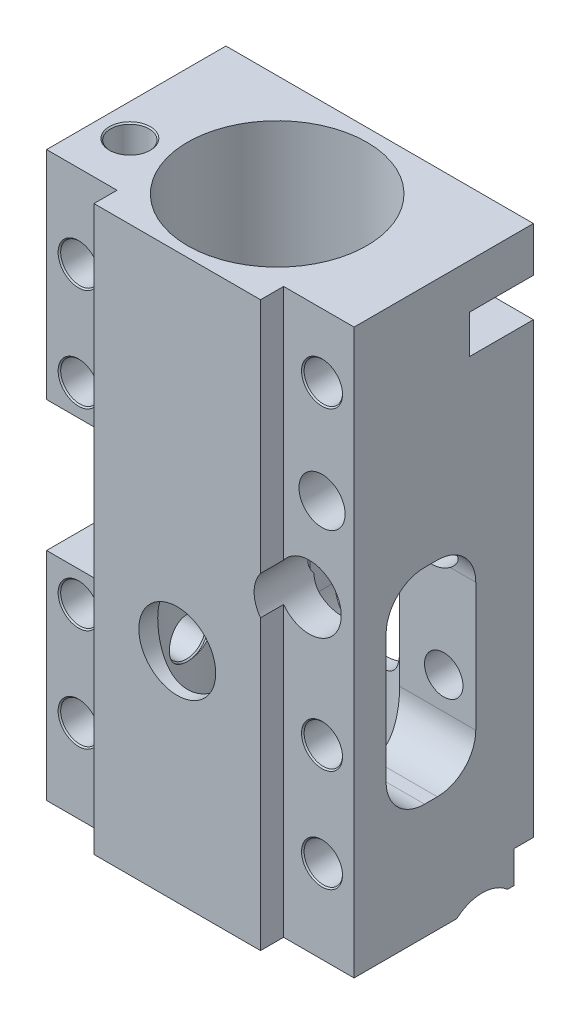
from build123d import *

# Parameters (mm, degrees)
SKETCH_2_R                 = 2.5
EXTRUDE_1_DEPTH            = 44
SKETCH_3_R                 = 7
CUT_EXTRUDE_1_DEPTH        = 42
CHAMFER_1_SIZE             = 2
CUT_EXTRUDE_START          = -37.5
CUT_EXTRUDE_10_DEPTH       = 3
CUT_EXTRUDE_2_REACH        = 50.266
CUT_EXTRUDE_2_END_RADIUS   = 7
CUT_EXTRUDE_3_REACH        = 52.754
CUT_EXTRUDE_3_END_RADIUS   = 7
HOLE_WIZARD_M3_D           = 3
HOLE_WIZARD_M3_CSINK_D     = 3.2
HOLE_WIZARD_M3_CSINK_ANGLE = 90
CUT_EXTRUDE_5_DEPTH        = 48.707441914
CUT_EXTRUDE_5_DEPTH_BACK   = 11
SKETCH_9_R                 = 2.5
CUT_EXTRUDE_6_DEPTH        = 48.369188443
CUT_EXTRUDE_6_DEPTH_BACK   = 48.369188443
SKETCH_10_R                = 1.5
SKETCH_10_R_2              = 1.8
CUT_EXTRUDE_11_REACH       = 50.266
CUT_EXTRUDE_11_END_RADIUS  = 7
SKETCH_14_R                = 3
SKETCH_15_W                = 14
SKETCH_15_H                = 10.2
CUT_EXTRUDE_13_DEPTH       = 4
SKETCH_16_W                = 1.5
SKETCH_16_H                = 2.5
CUT_EXTRUDE_14_DEPTH       = 51.754310312


# Read off the part's stored shape, not the designer's step: Отверстие M3_1, Отверстие обработанное метчиком M31
with BuildPart() as part:
    # Эскиз2 → Бобышка-Вытянуть1 (new body)
    with BuildSketch(Plane(origin=(0, 0, 0), x_dir=(1, 0, 0), z_dir=(0, 1, 0))):
        Polygon((-6.5, -7.8), (6.5, -7.8), (6.5, -6), (12, -6), (12, 8), (-12, 8), (-12, -6), (-6.5, -6), align=None)
        with Locations(Location((0, 0, 0), (0, 0, 270))):
            Circle(SKETCH_2_R, mode=Mode.SUBTRACT)
    extrude(amount=EXTRUDE_1_DEPTH)

    # Эскиз3 → Вырез-Вытянуть1 (cut)
    with BuildSketch(Plane(origin=(0, 44, 0), x_dir=(1, 0, 0), z_dir=(0, 1, 0))):
        with Locations(Location((0, 0, 0), (0, 0, 270))):
            Circle(SKETCH_3_R)
    extrude(amount=-CUT_EXTRUDE_1_DEPTH, mode=Mode.SUBTRACT)

    # Фаска1
    chamfer_1_edges = [part.edges().sort_by_distance(p)[0] for p in [
        (0, 2, -7),
    ]]
    chamfer(chamfer_1_edges, length=CHAMFER_1_SIZE)

    # Эскиз11 → Вырез-Вытянуть10 (cut)
    with BuildSketch(Plane.XZ.offset(CUT_EXTRUDE_START)):
        Polygon((12, -3), (7, -8), (12, -8), align=None)
    extrude(amount=-CUT_EXTRUDE_10_DEPTH, mode=Mode.SUBTRACT)

    # Вырез-Вытянуть2: up to this cylinder (the profile starts outside it)
    cut_extrude_2_end = Plane(origin=(0, 17, 0), z_dir=(0, 1, 0)) * Cylinder(CUT_EXTRUDE_2_END_RADIUS, 115.532, mode=Mode.PRIVATE)
    # Эскиз6 → Вырез-Вытянуть2 (cut, up to the surface)
    with BuildSketch(Plane(origin=(0, 0, -8), x_dir=(-1, 0, 0), z_dir=(0, 0, -1)), mode=Mode.PRIVATE) as cut_extrude_2_sk1:
        with BuildLine():
            Line((-0.5, 25), (0.5, 25))
            ThreePointArc((0.5, 25), (2.621320344, 24.121320344), (3.5, 22))
            Line((3.5, 22), (3.5, 12))
            ThreePointArc((3.5, 12), (2.621320344, 9.878679656), (0.5, 9))
            Line((0.5, 9), (-0.5, 9))
            ThreePointArc((-0.5, 9), (-2.621320344, 9.878679656), (-3.5, 12))
            Line((-3.5, 12), (-3.5, 22))
            ThreePointArc((-3.5, 22), (-2.621320344, 24.121320344), (-0.5, 25))
        make_face()
    cut_extrude_2_tool1 = extrude(cut_extrude_2_sk1.sketch, amount=-CUT_EXTRUDE_2_REACH, mode=Mode.PRIVATE) - cut_extrude_2_end
    add(cut_extrude_2_tool1.solids().sort_by_distance((0, 17, -8))[0], mode=Mode.SUBTRACT)

    # Вырез-Вытянуть3: up to this cylinder (the profile starts outside it)
    cut_extrude_3_end = Plane(origin=(0, 17, 0), z_dir=(0, 1, 0)) * Cylinder(CUT_EXTRUDE_3_END_RADIUS, 120.508, mode=Mode.PRIVATE)
    # Эскиз7 → Вырез-Вытянуть3 (cut, up to the surface)
    with BuildSketch(Plane(origin=(12, 0, 0), x_dir=(0, 0, -1), z_dir=(1, 0, 0)), mode=Mode.PRIVATE) as cut_extrude_3_sk1:
        with BuildLine():
            Line((-0.5, 25), (0.5, 25))
            ThreePointArc((0.5, 25), (2.621320344, 24.121320344), (3.5, 22))
            Line((3.5, 22), (3.5, 12))
            ThreePointArc((3.5, 12), (2.621320344, 9.878679656), (0.5, 9))
            Line((0.5, 9), (-0.5, 9))
            ThreePointArc((-0.5, 9), (-2.621320344, 9.878679656), (-3.5, 12))
            Line((-3.5, 12), (-3.5, 22))
            ThreePointArc((-3.5, 22), (-2.621320344, 24.121320344), (-0.5, 25))
        make_face()
    cut_extrude_3_tool1 = extrude(cut_extrude_3_sk1.sketch, amount=-CUT_EXTRUDE_3_REACH, mode=Mode.PRIVATE) - cut_extrude_3_end
    add(cut_extrude_3_tool1.solids().sort_by_distance((12, 17, 0))[0], mode=Mode.SUBTRACT)

    # Отверстие M3 (through all)
    with Locations(Plane.XY.offset(6)):
        with Locations((-9.5, 37.5), (-9.5, 6.5), (9.5, 6.5), (9.5, 39), (-9.5, 29.5), (-9.5, 14.5), (9.5, 14.5)):
            CounterSinkHole(HOLE_WIZARD_M3_D / 2, HOLE_WIZARD_M3_CSINK_D / 2, counter_sink_angle=HOLE_WIZARD_M3_CSINK_ANGLE)

    # Эскиз9 → Вырез-Вытянуть5 (cut, two sides: drawn at the far end of the back side and taken through both)
    with BuildSketch(Plane.XY.offset(6).offset(-CUT_EXTRUDE_5_DEPTH_BACK)):
        with Locations(Location((8.5, 24, 0), (0, 0, 216.869897646))):
            Circle(SKETCH_9_R)
    extrude(amount=CUT_EXTRUDE_5_DEPTH + CUT_EXTRUDE_5_DEPTH_BACK, mode=Mode.SUBTRACT)

    # Эскиз10 → Вырез-Вытянуть6 (cut, two sides: drawn at the far end of the back side and taken through both)
    with BuildSketch(Plane.XY.offset(-5).offset(-CUT_EXTRUDE_6_DEPTH_BACK)):
        with Locations((8.5, 24)):
            Circle(SKETCH_10_R)
        with Locations((9.5, 31)):
            Circle(SKETCH_10_R_2)
    extrude(amount=CUT_EXTRUDE_6_DEPTH + CUT_EXTRUDE_6_DEPTH_BACK, mode=Mode.SUBTRACT)

    # Отверстие M3_1 outline → Отверстие M3_1 (revolve, cut)
    with BuildSketch(Plane(origin=(0, 10.5, 0), x_dir=(0, 1, 0), z_dir=(0, 0, -1))):
        Polygon((1.6, -7.000000325), (1.6, -6.814611203), (0, -6.814611203), (0, -12), (1.6, -12), (1.5, -11.9), (1.5, -7.1), align=None)
    revolve(axis=Axis((0, 10.5, 0), (1, 0, 0)), mode=Mode.SUBTRACT)

    # Отверстие M3_1 2 outline → Отверстие M3_1 2 (revolve, cut)
    with BuildSketch(Plane(origin=(0, 33.5, 0), x_dir=(0, 1, 0), z_dir=(0, 0, -1))):
        Polygon((1.6, -7.000000325), (1.6, -6.814611203), (0, -6.814611203), (0, -12), (1.6, -12), (1.5, -11.9), (1.5, -7.1), align=None)
    revolve(axis=Axis((0, 33.5, 0), (1, 0, 0)), mode=Mode.SUBTRACT)

    # Вырез-Вытянуть11: up to this cylinder (the profile starts outside it)
    cut_extrude_11_end = Plane(origin=(0, 17, 0), z_dir=(0, 1, 0)) * Cylinder(CUT_EXTRUDE_11_END_RADIUS, 115.532, mode=Mode.PRIVATE)
    # Эскиз14 → Вырез-Вытянуть11 (cut, up to the surface)
    with BuildSketch(Plane.XY.offset(7.8), mode=Mode.PRIVATE) as cut_extrude_11_sk1:
        with Locations((0, 17)):
            Circle(SKETCH_14_R)
    cut_extrude_11_tool1 = extrude(cut_extrude_11_sk1.sketch, amount=-CUT_EXTRUDE_11_REACH, mode=Mode.PRIVATE) - cut_extrude_11_end
    add(cut_extrude_11_tool1.solids().sort_by_distance((0, 17, 7.8))[0], mode=Mode.SUBTRACT)

    # Эскиз15 → Вырез-Вытянуть13 (cut)
    with BuildSketch(Plane.ZY.offset(12)):
        with Locations((-1, 22)):
            Rectangle(SKETCH_15_W, SKETCH_15_H)
    extrude(amount=-CUT_EXTRUDE_13_DEPTH, mode=Mode.SUBTRACT)

    # Эскиз16 → Вырез-Вытянуть14 (cut, through all)
    with BuildSketch(Plane.ZY.offset(12)):
        with Locations((-7.25, 1.25)):
            Rectangle(SKETCH_16_W, SKETCH_16_H)
        with BuildLine():
            ThreePointArc((-2.015686517, 0), (-4, 0.75), (-5.984313483, 0))
            Line((-5.984313483, 0), (-2.015686517, 0))
        make_face()
        with BuildLine():
            Line((-2.015686517, 0), (-5.984313483, 0))
            ThreePointArc((-5.984313483, 0), (-5.234313483, -4.984313483), (-1, -2.25))
            ThreePointArc((-1, -2.25), (-1.265686517, -1.015686517), (-2.015686517, 0))
        make_face()
    extrude(amount=-CUT_EXTRUDE_14_DEPTH, mode=Mode.SUBTRACT)

    # Отверстие обработанное метчиком M31 outline → Отверстие обработанное метчиком M31 (revolve, cut)
    with BuildSketch(Plane(origin=(-9.5, 0, 2), x_dir=(1, 0, 0), z_dir=(0, 0, 1))):
        Polygon((0, 37.5), (1.5, 37.5), (1.5, 43.9), (1.6, 44), (0, 44), align=None)
    revolve(axis=Axis((-9.5, 0, 2), (0, 1, 0)), mode=Mode.SUBTRACT)


solid = part.part
